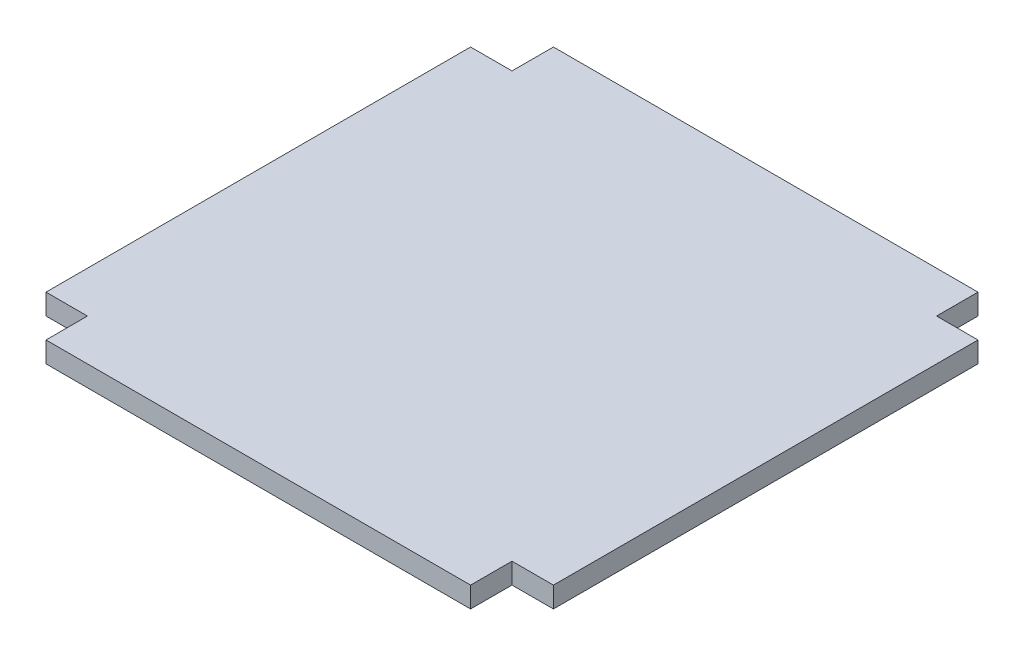
from build123d import *

# Parameters (mm, degrees)
SKETCH1_W           = 490
SKETCH1_H           = 490
BOSS_EXTRUDE1_DEPTH = 20
SKETCH2_W           = 40
SKETCH2_H           = 40
CUT_EXTRUDE1_DEPTH  = 348.059072782
SKETCH3_W           = 40
SKETCH3_H           = 40
CUT_EXTRUDE3_DEPTH  = 348.059072782


with BuildPart() as part:
    # Sketch1 → Boss-Extrude1 (new body)
    with BuildSketch(Plane(origin=(0, 0, 0), x_dir=(1, 0, 0), z_dir=(0, 1, 0))):
        Rectangle(SKETCH1_W, SKETCH1_H)
    extrude(amount=BOSS_EXTRUDE1_DEPTH)

    # Sketch2 → Cut-Extrude1 (cut, through all)
    with BuildSketch(Plane(origin=(0, 20, 0), x_dir=(1, 0, 0), z_dir=(0, 1, 0))):
        with Locations((-225, 225)):
            Rectangle(SKETCH2_W, SKETCH2_H)
    extrude(amount=-CUT_EXTRUDE1_DEPTH, mode=Mode.SUBTRACT)

    # Sketch3 → Cut-Extrude3 (cut, through all)
    with BuildSketch(Plane(origin=(0, 20, 0), x_dir=(1, 0, 0), z_dir=(0, 1, 0))):
        with Locations((225, 225)):
            Rectangle(SKETCH3_W, SKETCH3_H)
        with Locations((-225, -225)):
            Rectangle(SKETCH3_W, SKETCH3_H)
        with Locations((225, -225)):
            Rectangle(SKETCH3_W, SKETCH3_H)
    extrude(amount=-CUT_EXTRUDE3_DEPTH, mode=Mode.SUBTRACT)


solid = part.part
